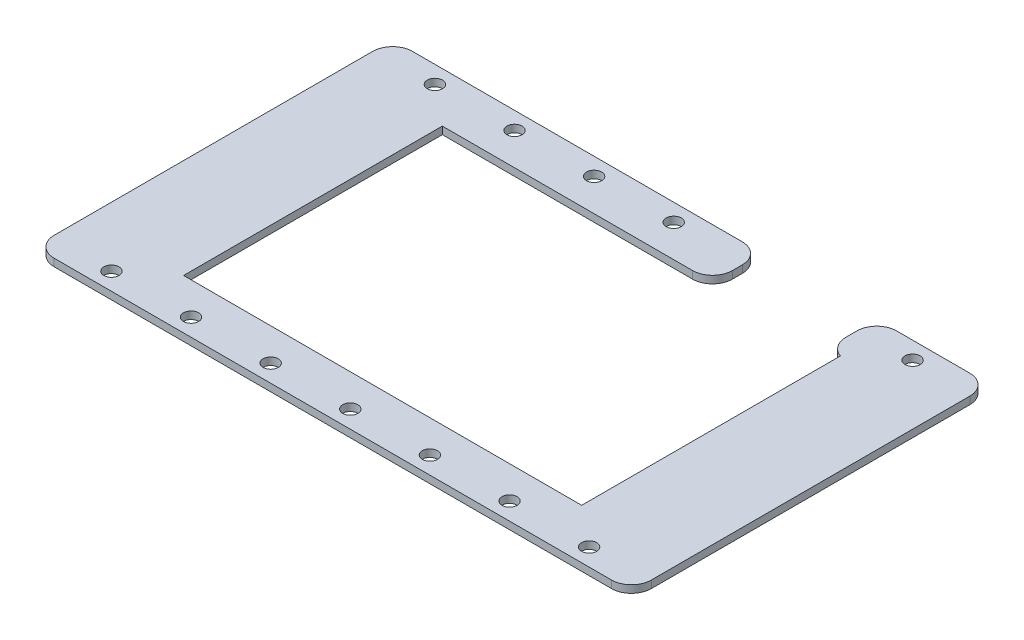
from build123d import *

# Parameters (mm, degrees)
SKETCH1_W          = 190.5
SKETCH1_H          = 114.3
SKETCH1_R          = 2.413
SKETCH1_W_2        = 127
SKETCH1_H_2        = 82.55
BASE_FLANGE1_DEPTH = 2.38125
FILLET1_R          = 6.35
SKETCH2_W          = 36.53028
SKETCH2_H          = 15.875
CUT_EXTRUDE1_DEPTH = 2.54
FILLET2_R          = 6.35


# Sheet-metal steps are written as plain solids
with BuildPart() as part:
    # Sketch1 → Base-Flange1 (new body)
    with BuildSketch(Plane(origin=(0, 0, 0), x_dir=(1, 0, 0), z_dir=(0, 1, 0))):
        Rectangle(SKETCH1_W, SKETCH1_H)
        with Locations(Location((-76.2, -51.59375, 0), (0, 0, 270))):
            Circle(SKETCH1_R, mode=Mode.SUBTRACT)
        with Locations(Location((-50.8, -51.59375, 0), (0, 0, 270))):
            Circle(SKETCH1_R, mode=Mode.SUBTRACT)
        with Locations(Location((-25.4, -51.59375, 0), (0, 0, 270))):
            Circle(SKETCH1_R, mode=Mode.SUBTRACT)
        with Locations(Location((0, -51.59375, 0), (0, 0, 270))):
            Circle(SKETCH1_R, mode=Mode.SUBTRACT)
        with Locations(Location((25.4, -51.59375, 0), (0, 0, 270))):
            Circle(SKETCH1_R, mode=Mode.SUBTRACT)
        with Locations(Location((50.8, -51.59375, 0), (0, 0, 270))):
            Circle(SKETCH1_R, mode=Mode.SUBTRACT)
        with Locations(Location((76.2, -51.59375, 0), (0, 0, 270))):
            Circle(SKETCH1_R, mode=Mode.SUBTRACT)
        with Locations(Location((76.2, 51.59375, 0), (0, 0, 270))):
            Circle(SKETCH1_R, mode=Mode.SUBTRACT)
        with Locations(Location((50.8, 51.59375, 0), (0, 0, 270))):
            Circle(SKETCH1_R, mode=Mode.SUBTRACT)
        with Locations(Location((25.4, 51.59375, 0), (0, 0, 270))):
            Circle(SKETCH1_R, mode=Mode.SUBTRACT)
        with Locations(Location((0, 51.59375, 0), (0, 0, 270))):
            Circle(SKETCH1_R, mode=Mode.SUBTRACT)
        with Locations(Location((-25.4, 51.59375, 0), (0, 0, 270))):
            Circle(SKETCH1_R, mode=Mode.SUBTRACT)
        with Locations(Location((-50.8, 51.59375, 0), (0, 0, 270))):
            Circle(SKETCH1_R, mode=Mode.SUBTRACT)
        with Locations(Location((-76.2, 51.59375, 0), (0, 0, 270))):
            Circle(SKETCH1_R, mode=Mode.SUBTRACT)
        Rectangle(SKETCH1_W_2, SKETCH1_H_2, mode=Mode.SUBTRACT)
    extrude(amount=-BASE_FLANGE1_DEPTH)

    # Fillet1
    fillet1_edges = [part.edges().sort_by_distance(p)[0] for p in [
        (-95.25, -1.190625, -57.15),
        (95.25, -1.190625, -57.15),
        (95.25, -1.190625, 57.15),
        (-95.25, -1.190625, 57.15),
    ]]
    fillet(fillet1_edges, radius=FILLET1_R)

    # Sketch2 → Cut-Extrude1 (cut)
    with BuildSketch(Plane(origin=(0, 0, 0), x_dir=(1, 0, 0), z_dir=(0, 1, 0))):
        with Locations((40.94988, 49.2125)):
            Rectangle(SKETCH2_W, SKETCH2_H)
    extrude(amount=-CUT_EXTRUDE1_DEPTH, mode=Mode.SUBTRACT)

    # Fillet2
    # the kernel refuses this fillet: 6.35 mm, written as the material it takes off along each edge
    with BuildSketch(Plane(origin=(59.21502, 15.012118521, -41.275), x_dir=(0, 0, -1), z_dir=(0, -1, 0))) as fillet2_piece_1:
        with BuildLine():
            CenterArc((6.004847409, 6.35), FILLET2_R, 198.977692365, 71.022307635)
            Line((0, 4.28498), (-0.120096948, 4.2436796))
            ThreePointArc((-0.120096948, 4.2436796), (-0.127, 2.14249), (-0.127, 0))
            Line((-0.127, 0), (0, -0.127))
            Line((0, -0.127), (6.004847409, -0.127))
            Line((6.004847409, -0.127), (6.004847409, 0))
        make_face()
    extrude(amount=32.405487043, mode=Mode.SUBTRACT)
    with BuildSketch(Plane(origin=(22.68474, 15.875, -41.275), x_dir=(-1, 0, 0), z_dir=(0, -1, 0)), Plane(origin=(22.68474, 15.875, -57.15), x_dir=(0, 0, 1), z_dir=(0, -1, 0)), Plane(origin=(59.21502, 15.875, -57.15), x_dir=(1, 0, 0), z_dir=(0, -1, 0))) as fillet2_piece_2:
        with BuildLine():
            CenterArc((FILLET2_R, FILLET2_R), FILLET2_R, 180, 90)
            Line((0, FILLET2_R), (-FILLET2_R * 0.02, FILLET2_R))
            Line((-FILLET2_R * 0.02, FILLET2_R), (-FILLET2_R * 0.02, -FILLET2_R * 0.02))
            Line((-FILLET2_R * 0.02, -FILLET2_R * 0.02), (FILLET2_R, -FILLET2_R * 0.02))
            Line((FILLET2_R, -FILLET2_R * 0.02), (FILLET2_R, 0))
        make_face()
    extrude(amount=34.13125, mode=Mode.SUBTRACT)


solid = part.part
